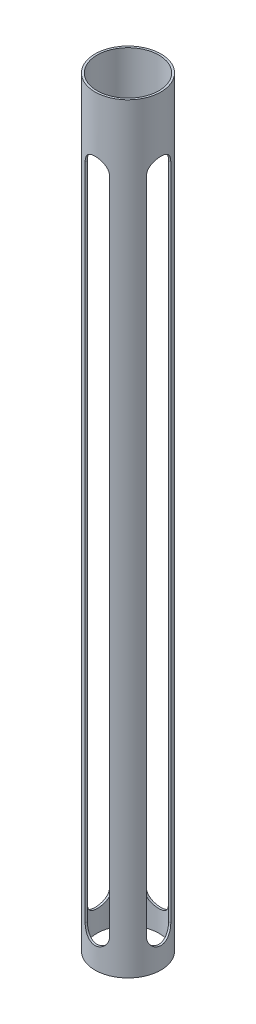
from build123d import *

# Parameters (mm, degrees)
SKETCH1_R           = 32.5
SKETCH1_R_2         = 30.5
BOSS_EXTRUDE1_DEPTH = 750
CUT_EXTRUDE1_DEPTH  = 50
CUT_EXTRUDE3_DEPTH  = 50


with BuildPart() as part:
    # Sketch1 → Boss-Extrude1 (new body)
    with BuildSketch(Plane(origin=(0, 0, 0), x_dir=(1, 0, 0), z_dir=(0, 1, 0))):
        Circle(SKETCH1_R)
        Circle(SKETCH1_R_2, mode=Mode.SUBTRACT)
    extrude(amount=BOSS_EXTRUDE1_DEPTH)

    # Sketch2 → Cut-Extrude1 (cut, symmetric)
    with BuildSketch(Plane.XY):
        with BuildLine():
            Line((12, 683.08072417), (12, 33.08072417))
            ThreePointArc((12, 33.08072417), (0, 21.08072417), (-12, 33.08072417))
            Line((-12, 33.08072417), (-12, 683.08072417))
            ThreePointArc((-12, 683.08072417), (0, 695.08072417), (12, 683.08072417))
        make_face()
    extrude(amount=CUT_EXTRUDE1_DEPTH, both=True, mode=Mode.SUBTRACT)

    # Sketch5 → Cut-Extrude3 (cut, symmetric)
    with BuildSketch(Plane(origin=(0, 0, 0), x_dir=(0, 0, -1), z_dir=(1, 0, 0))):
        with BuildLine():
            Line((12, 683.08072417), (12, 33.08072417))
            ThreePointArc((12, 33.08072417), (0, 21.08072417), (-12, 33.08072417))
            Line((-12, 33.08072417), (-12, 683.08072417))
            ThreePointArc((-12, 683.08072417), (0, 695.08072417), (12, 683.08072417))
        make_face()
    extrude(amount=CUT_EXTRUDE3_DEPTH, both=True, mode=Mode.SUBTRACT)


solid = part.part
